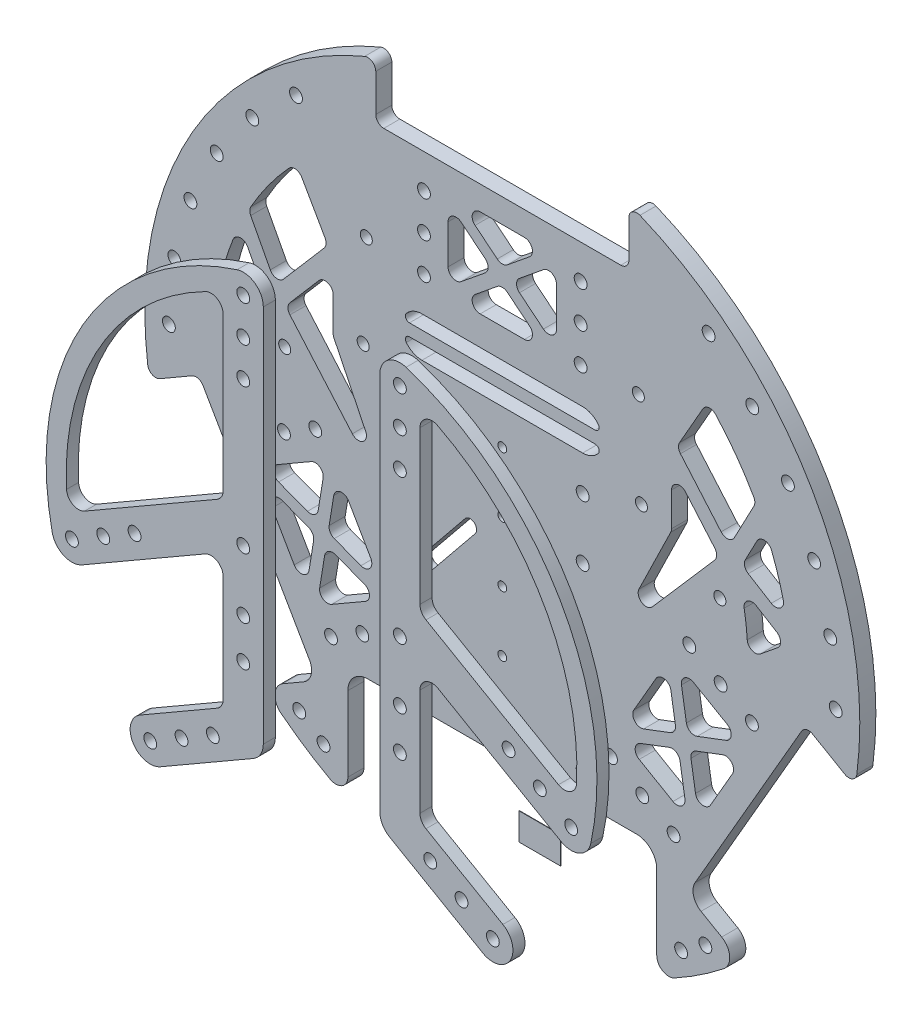
from build123d import *

# Parameters (mm, degrees)
SKETCH2_R             = 1.6
BOSS_EXTRUDE2_DEPTH   = 4
FILLET1_R             = 2
SKETCH6_R             = 1.6
CUT_EXTRUDE1_DEPTH    = 10
SKETCH14_R            = 1.6
CUT_EXTRUDE6_DEPTH    = 12
CRVPATTERN1_START     = -1
CRVPATTERN1_OUTLINE_R = 1.6
CRVPATTERN1_DEPTH     = 6
SKETCH15_W            = 27
SKETCH15_H            = 22
CUT_EXTRUDE8_DEPTH    = 12
EXTRUDE_THIN1_DEPTH   = 4
FILLET2_R             = 2
SKETCH18_R            = 1.5
CUT_EXTRUDE9_DEPTH    = 12
CUT_EXTRUDE10_DEPTH   = 10
CUT_EXTRUDE11_DEPTH   = 10
FILLET3_R             = 2
CUT_EXTRUDE12_START   = -10
CUT_EXTRUDE12_DEPTH   = 10
FILLET5_R             = 5
FILLET6_R             = 3
BOSS_EXTRUDE3_START   = -4
BOSS_EXTRUDE3_DEPTH   = 4
FILLET7_R             = 4
SKETCH29_R            = 1.6
CUT_EXTRUDE13_DEPTH   = 10
EXTRUDE_THIN5_DEPTH   = 4
FILLET8_DEPTH         = 4
BOSS_EXTRUDE4_DEPTH   = 3
FILLET9_R             = 3
FILLET10_R            = 3
BOSS_EXTRUDE5_DEPTH   = 3
FILLET11_R            = 3
FILLET12_R            = 3
SKETCH34_R            = 1.6
CUT_EXTRUDE14_DEPTH   = 131.743705865
SKETCH36_R            = 1.6
CUT_EXTRUDE15_DEPTH   = 5
SKETCH37_W            = 10.404424262
SKETCH37_H            = 6.743608318
BOSS_EXTRUDE6_DEPTH   = 0.1
SKETCH39_R            = 2.5
SKETCH39_R_2          = 1.1
BOSS_EXTRUDE7_DEPTH   = 4
CUT_EXTRUDE16_DEPTH   = 10
SKETCH41_W            = 50
SKETCH41_H            = 3
EXTRUDE_THIN7_DEPTH   = 4
FILLET13_R            = 1


with BuildPart() as part:
    # Sketch2 → Boss-Extrude2 (new body)
    with BuildSketch(Plane(origin=(0, 0, 0), x_dir=(-1, 0, 0), z_dir=(0, 0, 1))):
        with BuildLine():
            Line((-31.5, -83.239113402), (-31.5, -69))
            Line((-31.5, -69), (31.5, -69))
            Line((31.5, -69), (31.5, -83.239113402))
            ThreePointArc((31.5, -83.239113402), (73.227385588, -50.584088407), (89, 0))
            ThreePointArc((89, 0), (88.708820375, 7.193412794), (87.837186795, 14.339756482))
            Line((87.837186795, 14.339756482), (75.505752861, 7.220199781))
            Line((75.505752861, 7.220199781), (44.005752861, 61.779800219))
            Line((44.005752861, 61.779800219), (56.337186795, 68.89935692))
            ThreePointArc((56.337186795, 68.89935692), (0, 89), (-56.337186795, 68.89935692))
            Line((-56.337186795, 68.89935692), (-44.005752861, 61.779800219))
            Line((-44.005752861, 61.779800219), (-75.505752861, 7.220199781))
            Line((-75.505752861, 7.220199781), (-87.837186795, 14.339756482))
            ThreePointArc((-87.837186795, 14.339756482), (-77.076260937, -44.5), (-31.5, -83.239113402))
        make_face()
        with Locations(Location((-19.5, -60.5, 0), (0, 0, 180))):
            Circle(SKETCH2_R, mode=Mode.SUBTRACT)
        with Locations(Location((-19.5, -51.5, 0), (0, 0, 180))):
            Circle(SKETCH2_R, mode=Mode.SUBTRACT)
        with Locations(Location((-19.5, -42.5, 0), (0, 0, 180))):
            Circle(SKETCH2_R, mode=Mode.SUBTRACT)
        with Locations(Location((19.5, -60.5, 0), (0, 0, 180))):
            Circle(SKETCH2_R, mode=Mode.SUBTRACT)
        with Locations(Location((19.5, -51.5, 0), (0, 0, 180))):
            Circle(SKETCH2_R, mode=Mode.SUBTRACT)
        with Locations(Location((19.5, -42.5, 0), (0, 0, 180))):
            Circle(SKETCH2_R, mode=Mode.SUBTRACT)
        with Locations(Location((-46.556079661, 4.362504626, 0), (0, 0, 180))):
            Circle(SKETCH2_R, mode=Mode.SUBTRACT)
        with Locations(Location((-54.350308295, 8.862504626, 0), (0, 0, 180))):
            Circle(SKETCH2_R, mode=Mode.SUBTRACT)
        with Locations(Location((-62.144536929, 13.362504626, 0), (0, 0, 180))):
            Circle(SKETCH2_R, mode=Mode.SUBTRACT)
        with Locations(Location((-34.850308295, 42.637495374, 0), (0, 0, 180))):
            Circle(SKETCH2_R, mode=Mode.SUBTRACT)
        with Locations(Location((-27.056079661, 38.137495374, 0), (0, 0, 180))):
            Circle(SKETCH2_R, mode=Mode.SUBTRACT)
        with Locations(Location((-42.644536929, 47.137495374, 0), (0, 0, 180))):
            Circle(SKETCH2_R, mode=Mode.SUBTRACT)
        with Locations(Location((27.056079661, 38.137495374, 0), (0, 0, 180))):
            Circle(SKETCH2_R, mode=Mode.SUBTRACT)
        with Locations(Location((34.850308295, 42.637495374, 0), (0, 0, 180))):
            Circle(SKETCH2_R, mode=Mode.SUBTRACT)
        with Locations(Location((46.556079661, 4.362504626, 0), (0, 0, 180))):
            Circle(SKETCH2_R, mode=Mode.SUBTRACT)
        with Locations(Location((54.350308295, 8.862504626, 0), (0, 0, 180))):
            Circle(SKETCH2_R, mode=Mode.SUBTRACT)
        with Locations(Location((62.144536929, 13.362504626, 0), (0, 0, 180))):
            Circle(SKETCH2_R, mode=Mode.SUBTRACT)
        with Locations(Location((42.644536929, 47.137495374, 0), (0, 0, 180))):
            Circle(SKETCH2_R, mode=Mode.SUBTRACT)
    extrude(amount=BOSS_EXTRUDE2_DEPTH)

    # Fillet1
    fillet1_edges = [part.edges().sort_by_distance(p)[0] for p in [
        (75.505752861, -7.220199781, 2),
        (44.005752861, -61.779800219, 2),
        (56.337186795, -68.89935692, 2),
        (-56.337186795, -68.89935692, 2),
        (-44.005752861, -61.779800219, 2),
        (-75.505752861, -7.220199781, 2),
        (-87.837186795, -14.339756482, 2),
        (-31.5, 83.239113402, 2),
        (-31.5, 69, 2),
        (31.5, 69, 2),
        (31.5, 83.239113402, 2),
        (87.837186795, -14.339756482, 2),
    ]]
    fillet(fillet1_edges, radius=FILLET1_R)

    # Sketch6 → Cut-Extrude1 (cut)
    with BuildSketch(Plane.XY.offset(4)):
        with Locations((0, 15)):
            Circle(SKETCH6_R)
        Circle(SKETCH6_R)
        with Locations((0, -15)):
            Circle(SKETCH6_R)
        with Locations((0, -30)):
            Circle(SKETCH6_R)
        with Locations((0, -45)):
            Circle(SKETCH6_R)
        with Locations((0, -60)):
            Circle(SKETCH6_R)
        with Locations((0, -75)):
            Circle(SKETCH6_R)
        with Locations((-20, -75)):
            Circle(SKETCH6_R)
        with Locations((-20, -60)):
            Circle(SKETCH6_R)
        with Locations((-20, -45)):
            Circle(SKETCH6_R)
        with Locations((-20, -30)):
            Circle(SKETCH6_R)
        with Locations((-20, 0)):
            Circle(SKETCH6_R)
        with Locations((-20, 15)):
            Circle(SKETCH6_R)
        with Locations((20, -75)):
            Circle(SKETCH6_R)
        with Locations((20, -60)):
            Circle(SKETCH6_R)
        with Locations((20, -45)):
            Circle(SKETCH6_R)
        with Locations((20, -30)):
            Circle(SKETCH6_R)
        with Locations((20, 0)):
            Circle(SKETCH6_R)
        with Locations((20, 15)):
            Circle(SKETCH6_R)
    extrude(amount=-CUT_EXTRUDE1_DEPTH, mode=Mode.SUBTRACT)

    # Sketch14 → Cut-Extrude6 (cut)
    with BuildSketch(Plane.XY.offset(4)):
        with Locations((-83, 0)):
            Circle(SKETCH14_R)
    cut_extrude6 = extrude(amount=-CUT_EXTRUDE6_DEPTH, mode=Mode.SUBTRACT)

    # CrvPattern1: read off the stored shape, not the designer's step
    # CrvPattern1 outline → CrvPattern1 (cut)
    with BuildSketch(Plane.XY.offset(CRVPATTERN1_START)):
        with Locations((-51.358292788, 65.202191389)):
            Circle(CRVPATTERN1_OUTLINE_R)
        with Locations((-62.241362551, 54.909132099)):
            Circle(CRVPATTERN1_OUTLINE_R)
        with Locations((-71.097108739, 42.827574399)):
            Circle(CRVPATTERN1_OUTLINE_R)
        with Locations((-77.637082286, 29.351038383)):
            Circle(CRVPATTERN1_OUTLINE_R)
        with Locations((-81.648263392, 14.918481328)):
            Circle(CRVPATTERN1_OUTLINE_R)
    crvpattern1 = extrude(amount=CRVPATTERN1_DEPTH, mode=Mode.SUBTRACT)

    # Sketch15 → Cut-Extrude8 (cut)
    with BuildSketch(Plane.XY.offset(4)):
        with Locations((0, 52)):
            Rectangle(SKETCH15_W, SKETCH15_H)
        Polygon((61.309600438, -19.808657049), (47.809600438, -43.191342951), (28.757041555, -32.191342951), (42.257041555, -8.808657049), align=None)
        Polygon((-47.809600438, -43.191342951), (-61.309600438, -19.808657049), (-42.257041555, -8.808657049), (-28.757041555, -32.191342951), align=None)
    extrude(amount=-CUT_EXTRUDE8_DEPTH, mode=Mode.SUBTRACT)

    # Sketch16 → Extrude-Thin1 (add)
    with BuildSketch(Plane.XY.offset(4)):
        Polygon((-14.447509427, 61.837147522), (12.552490573, 39.837147522), (14.447509427, 42.162852478), (-12.552490573, 64.162852478), align=None)
        Polygon((12.552490573, 64.162852478), (-14.447509427, 42.162852478), (-12.552490573, 39.837147522), (14.447509427, 61.837147522), align=None)
        Polygon((60.776295365, -18.406663576), (28.223736481, -30.789349478), (29.290346629, -33.593336424), (61.842905512, -21.210650522), align=None)
        Polygon((49.290414939, -42.952201956), (43.737856056, -8.569516054), (40.776227055, -9.047798044), (46.328785938, -43.430483946), align=None)
        Polygon((-46.328785938, -43.430483946), (-40.776227055, -9.047798044), (-43.737856056, -8.569516054), (-49.290414939, -42.952201956), align=None)
        Polygon((-61.842905512, -21.210650522), (-29.290346629, -33.593336424), (-28.223736481, -30.789349478), (-60.776295365, -18.406663576), align=None)
    extrude(amount=-EXTRUDE_THIN1_DEPTH)

    # Fillet2
    fillet2_edges = [part.edges().sort_by_distance(p)[0] for p in [
        (-11.125353441, 41, 2),
        (11.125353441, 41, 2),
        (13.5, 61.065102804, 2),
        (13.5, 42.934897196, 2),
        (11.125353441, 63, 2),
        (-11.125353441, 63, 2),
        (-13.5, 42.934897196, 2),
        (-13.5, 61.065102804, 2),
        (-2.374646559, 52, 2),
        (0, 53.934897196, 2),
        (2.374646559, 52, 2),
        (0, 50.065102804, 2),
        (41.069718276, -10.865161294, 2),
        (29.944364835, -30.134838706, 2),
        (46.133930313, -42.223894353, 2),
        (30.432711681, -33.158791549, 2),
        (48.996923718, -41.134838706, 2),
        (60.122277159, -21.865161294, 2),
        (43.932711681, -9.776105647, 2),
        (59.633930313, -18.841208451, 2),
        (46.220644276, -23.943495755, 2),
        (46.708991123, -26.967448598, 2),
        (43.845997717, -28.056504245, 2),
        (43.357650871, -25.032551402, 2),
        (-29.944364835, -30.134838706, 2),
        (-41.069718276, -10.865161294, 2),
        (-59.633930313, -18.841208451, 2),
        (-43.932711681, -9.776105647, 2),
        (-60.122277159, -21.865161294, 2),
        (-48.996923718, -41.134838706, 2),
        (-30.432711681, -33.158791549, 2),
        (-46.133930313, -42.223894353, 2),
        (-43.845997717, -28.056504245, 2),
        (-46.708991123, -26.967448598, 2),
        (-46.220644276, -23.943495755, 2),
        (-43.357650871, -25.032551402, 2),
    ]]
    fillet(fillet2_edges, radius=FILLET2_R)

    # Sketch18 → Cut-Extrude9 (cut)
    with BuildSketch(Plane.XY.offset(4)):
        with Locations((-33.861381143, 43.340591448)):
            Circle(SKETCH18_R)
        with Locations((-34.641016151, 20)):
            Circle(SKETCH18_R)
        with Locations((-54.164426416, 9.550649772)):
            Circle(SKETCH18_R)
        with Locations((54.164426416, 9.550649772)):
            Circle(SKETCH18_R)
        with Locations((33.861381143, 43.340591448)):
            Circle(SKETCH18_R)
        with Locations((34.641016151, 20)):
            Circle(SKETCH18_R)
    extrude(amount=-CUT_EXTRUDE9_DEPTH, mode=Mode.SUBTRACT)

    # Sketch20 → Cut-Extrude10 (cut)
    with BuildSketch(Plane.XY.offset(4)):
        with BuildLine():
            Line((-21.242231703, -19.774285453), (-9.242231703, -4.991605039))
            ThreePointArc((-9.242231703, -4.991605039), (-6.991605039, -4.757768297), (-6.757768297, -7.008394961))
            Line((-6.757768297, -7.008394961), (-18.757768297, -21.791075375))
            ThreePointArc((-18.757768297, -21.791075375), (-21.008394961, -22.024912117), (-21.242231703, -19.774285453))
        make_face()
        with BuildLine():
            Line((21.242231703, -19.774285453), (9.242231703, -4.991605039))
            ThreePointArc((9.242231703, -4.991605039), (6.991605039, -4.757768297), (6.757768297, -7.008394961))
            Line((6.757768297, -7.008394961), (18.757768297, -21.791075375))
            ThreePointArc((18.757768297, -21.791075375), (21.008394961, -22.024912117), (21.242231703, -19.774285453))
        make_face()
    extrude(amount=-CUT_EXTRUDE10_DEPTH, mode=Mode.SUBTRACT)

    # Mirror1: Cut-Extrude6, CrvPattern1 across plane
    add(cut_extrude6.mirror(Plane.ZY), mode=Mode.SUBTRACT)
    add(crvpattern1.mirror(Plane.ZY), mode=Mode.SUBTRACT)

    # Sketch25 → Cut-Extrude11 (cut)
    with BuildSketch(Plane.XY.offset(4)):
        with BuildLine():
            Line((-45.60881259, 40.663577541), (-51.25208965, 50.568995506))
            ThreePointArc((-51.25208965, 50.568995506), (-58.929226505, 41.36842109), (-64.974112454, 31.022003655))
            Line((-64.974112454, 31.022003655), (-57.043295074, 21.903260293))
            ThreePointArc((-57.043295074, 21.903260293), (-52.176155261, 31.80155887), (-45.60881259, 40.663577541))
        make_face()
        with BuildLine():
            Line((-42.115005319, 34.531037716), (-45.60881259, 40.663577541))
            ThreePointArc((-45.60881259, 40.663577541), (-52.176155261, 31.80155887), (-57.043295074, 21.903260293))
            Line((-57.043295074, 21.903260293), (-27.372248825, -12.212095415))
            Line((-27.372248825, -12.212095415), (-42.115005319, 18.019554165))
            Line((-42.115005319, 18.019554165), (-42.115005319, 34.531037716))
        make_face()
        with BuildLine():
            Line((-57.043295074, 21.903260293), (-64.974112454, 31.022003655))
            ThreePointArc((-64.974112454, 31.022003655), (-69.162799491, 20.012675147), (-71.500335484, 8.467704866))
            Line((-71.500335484, 8.467704866), (-61.103930515, 0))
            ThreePointArc((-61.103930515, 0), (-60.080195834, 11.138240118), (-57.043295074, 21.903260293))
        make_face()
        with BuildLine():
            ThreePointArc((57.043295074, 21.903260293), (52.176155261, 31.80155887), (45.60881259, 40.663577541))
            Line((45.60881259, 40.663577541), (42.115005319, 34.531037716))
            Line((42.115005319, 34.531037716), (42.115005319, 18.019554165))
            Line((42.115005319, 18.019554165), (27.372248825, -12.212095415))
            Line((27.372248825, -12.212095415), (57.043295074, 21.903260293))
        make_face()
        with BuildLine():
            ThreePointArc((64.974112454, 31.022003655), (58.929226505, 41.36842109), (51.25208965, 50.568995506))
            Line((51.25208965, 50.568995506), (45.60881259, 40.663577541))
            ThreePointArc((45.60881259, 40.663577541), (52.176155261, 31.80155887), (57.043295074, 21.903260293))
            Line((57.043295074, 21.903260293), (64.974112454, 31.022003655))
        make_face()
        with BuildLine():
            ThreePointArc((71.500335484, 8.467704866), (69.162799491, 20.012675147), (64.974112454, 31.022003655))
            Line((64.974112454, 31.022003655), (57.043295074, 21.903260293))
            ThreePointArc((57.043295074, 21.903260293), (60.080195834, 11.138240118), (61.103930515, 0))
            Line((61.103930515, 0), (71.500335484, 8.467704866))
        make_face()
    extrude(amount=-CUT_EXTRUDE11_DEPTH, mode=Mode.SUBTRACT)

    # Fillet3
    fillet3_edges = [part.edges().sort_by_distance(p)[0] for p in [
        (-57.043295074, 21.903260293, 2),
        (-61.103930515, 0, 2),
        (-71.500335484, 8.467704866, 2),
        (-51.25208965, 50.568995506, 2),
        (-42.115005319, 34.531037716, 2),
        (-42.115005319, 18.019554165, 2),
        (-27.372248825, -12.212095415, 2),
        (57.043295074, 21.903260293, 2),
        (27.372248825, -12.212095415, 2),
        (42.115005319, 18.019554165, 2),
        (42.115005319, 34.531037716, 2),
        (51.25208965, 50.568995506, 2),
        (71.500335484, 8.467704866, 2),
        (61.103930515, 0, 2),
    ]]
    fillet(fillet3_edges, radius=FILLET3_R)

    # Sketch27 → Cut-Extrude12 (cut)
    with BuildSketch(Plane.XY.offset(4).offset(CUT_EXTRUDE12_START)):
        with BuildLine():
            Line((-38.447158109, -80.267154137), (-38.447158109, -51.691106138))
            Line((-38.447158109, -51.691106138), (38.447158109, -51.691106138))
            Line((38.447158109, -51.691106138), (38.447158109, -80.267154137))
            ThreePointArc((38.447158109, -80.267154137), (0, -89), (-38.447158109, -80.267154137))
        make_face()
    extrude(amount=CUT_EXTRUDE12_DEPTH, mode=Mode.SUBTRACT)

    # Fillet5
    fillet5_edges = [part.edges().sort_by_distance(p)[0] for p in [
        (-38.447158109, -51.691106138, 2),
        (38.447158109, -51.691106138, 2),
    ]]
    fillet(fillet5_edges, radius=FILLET5_R)

    # Fillet6
    fillet6_edges = [part.edges().sort_by_distance(p)[0] for p in [
        (38.447158109, -80.267154137, 2),
        (-38.447158109, -80.267154137, 2),
    ]]
    fillet(fillet6_edges, radius=FILLET6_R)

    # Sketch28 → Boss-Extrude3 (add)
    with BuildSketch(Plane.XY.offset(4).offset(BOSS_EXTRUDE3_START)):
        with BuildLine():
            Line((-59.554587169, -66.138121739), (-46.005752861, -58.315698604))
            Line((-46.005752861, -58.315698604), (-45.005752861, -60.047749412))
            ThreePointArc((-45.005752861, -60.047749412), (-44.805952016, -61.565387502), (-45.737803669, -62.779800219))
            Line((-45.737803669, -62.779800219), (-53.784613683, -67.425628147))
            ThreePointArc((-53.784613683, -67.425628147), (-54.780498032, -69.029438312), (-53.998053078, -70.747510655))
            ThreePointArc((-53.998053078, -70.747510655), (-56.823077559, -68.499181431), (-59.554587169, -66.138121739))
        make_face()
        with BuildLine():
            Line((46.005752861, -58.315698604), (45.005752861, -60.047749412))
            ThreePointArc((45.005752861, -60.047749412), (44.805952016, -61.565387502), (45.737803669, -62.779800219))
            Line((45.737803669, -62.779800219), (53.784613683, -67.425628147))
            ThreePointArc((53.784613683, -67.425628147), (54.780498032, -69.029438312), (53.998053078, -70.747510655))
            ThreePointArc((53.998053078, -70.747510655), (56.823077559, -68.499181431), (59.554587169, -66.138121739))
            Line((59.554587169, -66.138121739), (46.005752861, -58.315698604))
        make_face()
    extrude(amount=BOSS_EXTRUDE3_DEPTH)

    # Fillet7
    fillet7_edges = [part.edges().sort_by_distance(p)[0] for p in [
        (-59.554587169, -66.138121739, 2),
        (-46.005752861, -58.315698604, 2),
        (46.005752861, -58.315698604, 2),
        (59.554587169, -66.138121739, 2),
    ]]
    fillet(fillet7_edges, radius=FILLET7_R)

    # Sketch29 → Cut-Extrude13 (cut)
    with BuildSketch(Plane.XY.offset(4)):
        with Locations((-50.552461945, -67.085382844)):
            Circle(SKETCH29_R)
        with Locations((-44.513218196, -71.236040077)):
            Circle(SKETCH29_R)
        with Locations((44.513218196, -71.236040077)):
            Circle(SKETCH29_R)
        with Locations((50.552461945, -67.085382844)):
            Circle(SKETCH29_R)
    extrude(amount=-CUT_EXTRUDE13_DEPTH, mode=Mode.SUBTRACT)

    # Sketch30 → Extrude-Thin5 (add)
    with BuildSketch(Plane.XY.offset(4)):
        Polygon((-54.900927203, 17.362874752), (-39.036044939, 35.820335158), (-42.06947896, 38.427685928), (-57.934361224, 19.970225522), align=None)
        Polygon((-67.212879237, 33.728533867), (-58.784303311, 17.73414963), (-55.245586428, 19.598950643), (-63.674162354, 35.59333488), align=None)
        Polygon((-71.764418637, 7.205857639), (-56.243823347, 16.72707487), (-58.335443849, 20.136638431), (-73.85603914, 10.6154212), align=None)
        Polygon((57.934361224, 19.970225522), (42.06947896, 38.427685928), (39.036044939, 35.820335158), (54.900927203, 17.362874752), align=None)
        Polygon((73.85603914, 10.6154212), (58.335443849, 20.136638431), (56.243823347, 16.72707487), (71.764418637, 7.205857639), align=None)
        Polygon((63.674162354, 35.59333488), (55.245586428, 19.598950643), (58.784303311, 17.73414963), (67.212879237, 33.728533867), align=None)
    extrude(amount=-EXTRUDE_THIN5_DEPTH)

    # Fillet8: read off the stored shape, not the designer's step
    # Fillet8 outline → Fillet8 (add)
    with BuildSketch(Plane.XY):
        with BuildLine():
            ThreePointArc((-68.543569567, 6.059466517), (-69.276094486, 7.743343966), (-68.326342307, 9.314969499))
            Line((-68.326342307, 9.314969499), (-70.727121249, 7.842194943))
            ThreePointArc((-70.727121249, 7.842194943), (-70.684157671, 7.804006529), (-70.640114371, 7.767068586))
            Line((-70.640114371, 7.767068586), (-68.543569567, 6.059466517))
        make_face()
        with BuildLine():
            ThreePointArc((-63.229627341, 12.441584777), (-61.061543366, 12.392249067), (-60.212978931, 10.39651348))
            ThreePointArc((-60.212978931, 10.39651348), (-59.781515869, 12.643602521), (-59.26622414, 14.872962062))
            Line((-59.26622414, 14.872962062), (-63.229627341, 12.441584777))
        make_face()
        with BuildLine():
            Line((-59.631397127, 19.34162687), (-60.504847484, 20.99911928))
            ThreePointArc((-60.504847484, 20.99911928), (-60.345481919, 19.537546114), (-61.228395674, 18.361936994))
            Line((-61.228395674, 18.361936994), (-59.631397127, 19.34162687))
        make_face()
        with BuildLine():
            ThreePointArc((-67.029561536, 26.287599364), (-65.278816581, 27.554295225), (-63.398270829, 26.489788778))
            Line((-63.398270829, 26.489788778), (-65.357061011, 30.206863061))
            ThreePointArc((-65.357061011, 30.206863061), (-66.222312058, 28.259606962), (-67.029561536, 26.287599364))
        make_face()
        with BuildLine():
            Line((-70.921443556, 12.41566929), (-66.971117667, 14.839024208))
            ThreePointArc((-66.971117667, 14.839024208), (-69.194520975, 14.927243403), (-69.960268716, 17.016486159))
            ThreePointArc((-69.960268716, 17.016486159), (-70.478408695, 14.723922978), (-70.921443556, 12.41566929))
        make_face()
        with BuildLine():
            ThreePointArc((-44.129692263, 38.067336933), (-43.876682332, 36.885447704), (-44.35074193, 35.773627723))
            Line((-44.35074193, 35.773627723), (-43.431931906, 36.842586154))
            Line((-43.431931906, 36.842586154), (-44.129692263, 38.067336933))
        make_face()
        with BuildLine():
            ThreePointArc((-54.472954777, 23.997281719), (-56.214211722, 23.313601621), (-57.75903023, 24.368556598))
            Line((-57.75903023, 24.368556598), (-56.388800164, 21.768356236))
            Line((-56.388800164, 21.768356236), (-54.472954777, 23.997281719))
        make_face()
        with BuildLine():
            ThreePointArc((-62.640574787, 33.631960049), (-62.870969287, 34.595795797), (-62.610393955, 35.551913714))
            ThreePointArc((-62.610393955, 35.551913714), (-62.880109328, 35.072665295), (-63.146156386, 34.591370799))
            Line((-63.146156386, 34.591370799), (-62.640574787, 33.631960049))
        make_face()
        with BuildLine():
            Line((-42.115005319, 32.238222895), (-45.63172233, 28.146817494))
            ThreePointArc((-45.63172233, 28.146817494), (-43.41981974, 28.718433289), (-42.115005319, 26.843142109))
            Line((-42.115005319, 26.843142109), (-42.115005319, 32.238222895))
        make_face()
        with BuildLine():
            ThreePointArc((-52.868175462, 17.102765916), (-53.359076821, 18.409431839), (-52.87580233, 19.718937755))
            Line((-52.87580233, 19.718937755), (-54.002985477, 18.407554666))
            Line((-54.002985477, 18.407554666), (-52.868175462, 17.102765916))
        make_face()
        with BuildLine():
            Line((70.727121249, 7.842194943), (68.326342307, 9.314969499))
            ThreePointArc((68.326342307, 9.314969499), (69.276094486, 7.743343966), (68.543569567, 6.059466517))
            Line((68.543569567, 6.059466517), (70.640114371, 7.767068586))
            ThreePointArc((70.640114371, 7.767068586), (70.684157671, 7.804006529), (70.727121249, 7.842194943))
        make_face()
        with BuildLine():
            ThreePointArc((60.212978931, 10.39651348), (61.061543366, 12.392249067), (63.229627341, 12.441584777))
            Line((63.229627341, 12.441584777), (59.26622414, 14.872962062))
            ThreePointArc((59.26622414, 14.872962062), (59.781515869, 12.643602521), (60.212978931, 10.39651348))
        make_face()
        with BuildLine():
            ThreePointArc((63.398270829, 26.489788778), (65.278816581, 27.554295225), (67.029561536, 26.287599364))
            ThreePointArc((67.029561536, 26.287599364), (66.222312058, 28.259606962), (65.357061011, 30.206863061))
            Line((65.357061011, 30.206863061), (63.398270829, 26.489788778))
        make_face()
        with BuildLine():
            ThreePointArc((70.921443556, 12.41566929), (70.478408695, 14.723922978), (69.960268716, 17.016486159))
            ThreePointArc((69.960268716, 17.016486159), (69.194520975, 14.927243403), (66.971117667, 14.839024208))
            Line((66.971117667, 14.839024208), (70.921443556, 12.41566929))
        make_face()
        with BuildLine():
            ThreePointArc((61.228395674, 18.361936994), (60.345481919, 19.537546114), (60.504847484, 20.99911928))
            Line((60.504847484, 20.99911928), (59.631397127, 19.34162687))
            Line((59.631397127, 19.34162687), (61.228395674, 18.361936994))
        make_face()
        with BuildLine():
            Line((56.388800164, 21.768356236), (57.75903023, 24.368556598))
            ThreePointArc((57.75903023, 24.368556598), (56.214211722, 23.313601621), (54.472954777, 23.997281719))
            Line((54.472954777, 23.997281719), (56.388800164, 21.768356236))
        make_face()
        with BuildLine():
            ThreePointArc((62.610393955, 35.551913714), (62.870969287, 34.595795797), (62.640574787, 33.631960049))
            Line((62.640574787, 33.631960049), (63.146156386, 34.591370799))
            ThreePointArc((63.146156386, 34.591370799), (62.880109328, 35.072665295), (62.610393955, 35.551913714))
        make_face()
        with BuildLine():
            Line((43.431931906, 36.842586154), (44.35074193, 35.773627723))
            ThreePointArc((44.35074193, 35.773627723), (43.876682332, 36.885447704), (44.129692263, 38.067336933))
            Line((44.129692263, 38.067336933), (43.431931906, 36.842586154))
        make_face()
        with BuildLine():
            Line((54.002985477, 18.407554666), (52.87580233, 19.718937755))
            ThreePointArc((52.87580233, 19.718937755), (53.359076821, 18.409431839), (52.868175462, 17.102765916))
            Line((52.868175462, 17.102765916), (54.002985477, 18.407554666))
        make_face()
        with BuildLine():
            ThreePointArc((42.115005319, 26.843142109), (43.41981974, 28.718433289), (45.63172233, 28.146817494))
            Line((45.63172233, 28.146817494), (42.115005319, 32.238222895))
            Line((42.115005319, 32.238222895), (42.115005319, 26.843142109))
        make_face()
    extrude(amount=FILLET8_DEPTH)

    # Sketch39 → Boss-Extrude7 (add)
    # profile 1 of 5: a face of its own
    with BuildSketch(Plane.XY.offset(4)):
        with Locations((0, 15)):
            Circle(SKETCH39_R)
        with Locations((0, 15)):
            Circle(SKETCH39_R_2, mode=Mode.SUBTRACT)
    # profile 2 of 5: a face of its own
    with BuildSketch(Plane.XY.offset(4)):
        Circle(SKETCH39_R)
        Circle(SKETCH39_R_2, mode=Mode.SUBTRACT)
    # profile 3 of 5: a face of its own
    with BuildSketch(Plane.XY.offset(4)):
        with Locations((0, -15)):
            Circle(SKETCH39_R)
        with Locations((0, -15)):
            Circle(SKETCH39_R_2, mode=Mode.SUBTRACT)
    # profile 4 of 5: a face of its own
    with BuildSketch(Plane.XY.offset(4)):
        with Locations((0, -30)):
            Circle(SKETCH39_R)
        with Locations((0, -30)):
            Circle(SKETCH39_R_2, mode=Mode.SUBTRACT)
    # profile 5 of 5: a face of its own
    with BuildSketch(Plane.XY.offset(4)):
        with Locations((0, -45)):
            Circle(SKETCH39_R)
        with Locations((0, -45)):
            Circle(SKETCH39_R_2, mode=Mode.SUBTRACT)
    extrude(amount=-BOSS_EXTRUDE7_DEPTH)

    # Sketch40 → Cut-Extrude16 (cut)
    with BuildSketch(Plane(origin=(0, 0, 0), x_dir=(-1, 0, 0), z_dir=(0, 0, -1))):
        with BuildLine():
            Line((-20, 33.754545455), (20, 33.754545455))
            ThreePointArc((20, 33.754545455), (25, 28.754545455), (20, 23.754545455))
            Line((20, 23.754545455), (-20, 23.754545455))
            ThreePointArc((-20, 23.754545455), (-25, 28.754545455), (-20, 33.754545455))
        make_face()
    extrude(amount=-CUT_EXTRUDE16_DEPTH, mode=Mode.SUBTRACT)

    # Sketch41 → Extrude-Thin7 (add)
    with BuildSketch(Plane(origin=(0, 0, 0), x_dir=(-1, 0, 0), z_dir=(0, 0, -1))):
        with Locations((0, 28.754545455)):
            Rectangle(SKETCH41_W, SKETCH41_H)
    extrude(amount=-EXTRUDE_THIN7_DEPTH)

    # Fillet13
    fillet13_edges = [part.edges().sort_by_distance(p)[0] for p in [
        (-24.769696007, 30.254545455, 2),
        (-24.769696007, 27.254545455, 2),
        (24.769696007, 27.254545455, 2),
        (24.769696007, 30.254545455, 2),
    ]]
    fillet(fillet13_edges, radius=FILLET13_R)


with BuildPart() as body_2:
    # Sketch32 → Boss-Extrude4 (new body)
    with BuildSketch(Plane.XY.offset(46)):
        with BuildLine():
            Line((-24.5, -37.020423453), (-24.5, -30.888239402))
            Line((-24.5, -30.888239402), (-45.144536929, -42.807368355))
            ThreePointArc((-45.144536929, -42.807368355), (-46.974663948, -49.637495374), (-40.144536929, -51.467622393))
            Line((-40.144536929, -51.467622393), (-22.298253984, -41.164066131))
            ThreePointArc((-22.298253984, -41.164066131), (-23.915386162, -39.366561778), (-24.5, -37.020423453))
        make_face()
        with BuildLine():
            ThreePointArc((-17, -38.105117767), (-15.169872981, -36.274990748), (-14.5, -33.774990748))
            ThreePointArc((-14.5, -33.774990748), (-17, -29.444863729), (-22, -29.444863729))
            Line((-22, -29.444863729), (-24.5, -30.888239402))
            Line((-24.5, -30.888239402), (-24.5, -37.020423453))
            ThreePointArc((-24.5, -37.020423453), (-23.915386162, -39.366561778), (-22.298253984, -41.164066131))
            Line((-22.298253984, -41.164066131), (-17, -38.105117767))
        make_face()
        with BuildLine():
            Line((-14.5, -33.774990748), (-14.5, 8.371578903))
            Line((-14.5, 8.371578903), (-24.5, 2.598076211))
            Line((-24.5, 2.598076211), (-24.5, -30.888239402))
            Line((-24.5, -30.888239402), (-22, -29.444863729))
            ThreePointArc((-22, -29.444863729), (-17, -29.444863729), (-14.5, -33.774990748))
        make_face()
        with BuildLine():
            Line((-24.5, 2.598076211), (-24.5, 14.145081595))
            Line((-24.5, 14.145081595), (-64.644536929, -9.032377607))
            ThreePointArc((-64.644536929, -9.032377607), (-66.474663948, -15.862504626), (-59.644536929, -17.692631645))
            Line((-59.644536929, -17.692631645), (-24.5, 2.598076211))
        make_face()
        Polygon((-14.5, 8.371578903), (-14.5, 19.918584287), (-24.5, 14.145081595), (-24.5, 2.598076211), align=None)
        with BuildLine():
            Line((-14.5, 19.918584287), (-14.5, 60.5))
            ThreePointArc((-14.5, 60.5), (-19.5, 65.5), (-24.5, 60.5))
            Line((-24.5, 60.5), (-24.5, 14.145081595))
            Line((-24.5, 14.145081595), (-14.5, 19.918584287))
        make_face()
        with BuildLine():
            Line((14.5, 60.5), (14.5, 19.918584287))
            Line((14.5, 19.918584287), (24.5, 14.145081595))
            Line((24.5, 14.145081595), (24.5, 60.5))
            ThreePointArc((24.5, 60.5), (19.5, 65.5), (14.5, 60.5))
        make_face()
        Polygon((14.5, 19.918584287), (14.5, 8.371578903), (24.5, 2.598076211), (24.5, 14.145081595), align=None)
        with BuildLine():
            Line((24.5, 14.145081595), (24.5, 2.598076211))
            Line((24.5, 2.598076211), (59.644536929, -17.692631645))
            ThreePointArc((59.644536929, -17.692631645), (66.474663948, -15.862504626), (64.644536929, -9.032377607))
            Line((64.644536929, -9.032377607), (24.5, 14.145081595))
        make_face()
        with BuildLine():
            Line((24.5, 2.598076211), (14.5, 8.371578903))
            Line((14.5, 8.371578903), (14.5, -33.774990748))
            ThreePointArc((14.5, -33.774990748), (17, -29.444863729), (22, -29.444863729))
            Line((22, -29.444863729), (24.5, -30.888239402))
            Line((24.5, -30.888239402), (24.5, 2.598076211))
        make_face()
        with BuildLine():
            ThreePointArc((22, -29.444863729), (17, -29.444863729), (14.5, -33.774990748))
            ThreePointArc((14.5, -33.774990748), (15.169872981, -36.274990748), (17, -38.105117767))
            Line((17, -38.105117767), (22.298253984, -41.164066131))
            ThreePointArc((22.298253984, -41.164066131), (23.915386162, -39.366561778), (24.5, -37.020423453))
            Line((24.5, -37.020423453), (24.5, -30.888239402))
            Line((24.5, -30.888239402), (22, -29.444863729))
        make_face()
        with BuildLine():
            Line((45.144536929, -42.807368355), (24.5, -30.888239402))
            Line((24.5, -30.888239402), (24.5, -37.020423453))
            ThreePointArc((24.5, -37.020423453), (23.915386162, -39.366561778), (22.298253984, -41.164066131))
            Line((22.298253984, -41.164066131), (40.144536929, -51.467622393))
            ThreePointArc((40.144536929, -51.467622393), (46.974663948, -49.637495374), (45.144536929, -42.807368355))
        make_face()
    extrude(amount=BOSS_EXTRUDE4_DEPTH)

    # Fillet9
    fillet9_edges = [body_2.edges().sort_by_distance(p)[0] for p in [
        (-24.5, -30.888239402, 47.5),
        (-24.5, 2.598076211, 47.5),
        (-24.5, 14.145081595, 47.5),
    ]]
    fillet(fillet9_edges, radius=FILLET9_R)

    # Fillet10
    fillet10_edges = [body_2.edges().sort_by_distance(p)[0] for p in [
        (24.5, 14.145081595, 47.5),
        (24.5, 2.598076211, 47.5),
        (24.5, -30.888239402, 47.5),
    ]]
    fillet(fillet10_edges, radius=FILLET10_R)

    # Sketch33 → Boss-Extrude5 (add)
    with BuildSketch(Plane.XY.offset(49)):
        with BuildLine():
            Line((-21.033864726, 65.258913637), (-19.5, 60.5))
            ThreePointArc((-19.5, 60.5), (-55.04884195, 31.782463718), (-62.144536929, -13.362504626))
            Line((-62.144536929, -13.362504626), (-67.032809396, -14.413595626))
            ThreePointArc((-67.032809396, -14.413595626), (-59.378968969, 34.282463718), (-21.033864726, 65.258913637))
        make_face()
        with BuildLine():
            Line((67.032809396, -14.413595626), (62.144536929, -13.362504626))
            ThreePointArc((62.144536929, -13.362504626), (55.04884195, 31.782463718), (19.5, 60.5))
            Line((19.5, 60.5), (21.033864726, 65.258913637))
            ThreePointArc((21.033864726, 65.258913637), (59.378968969, 34.282463718), (67.032809396, -14.413595626))
        make_face()
    extrude(amount=-BOSS_EXTRUDE5_DEPTH)

    # Fillet11
    fillet11_edges = [body_2.edges().sort_by_distance(p)[0] for p in [
        (-63.045546065, -8.109199801, 47.5),
        (-24.5, 58.653644388, 47.5),
    ]]
    fillet(fillet11_edges, radius=FILLET11_R)

    # Fillet12
    fillet12_edges = [body_2.edges().sort_by_distance(p)[0] for p in [
        (24.5, 58.653644388, 47.5),
        (63.045546065, -8.109199801, 47.5),
    ]]
    fillet(fillet12_edges, radius=FILLET12_R)

    # Sketch34 → Cut-Extrude14 (cut, through all)
    with BuildSketch(Plane.XY.offset(49)):
        with Locations((62.144536929, -13.362504626)):
            Circle(SKETCH34_R)
        with Locations((54.350308295, -8.862504626)):
            Circle(SKETCH34_R)
        with Locations((46.556079661, -4.362504626)):
            Circle(SKETCH34_R)
        with Locations((27.056079661, -38.137495374)):
            Circle(SKETCH34_R)
        with Locations((34.850308295, -42.637495374)):
            Circle(SKETCH34_R)
        with Locations((42.644536929, -47.137495374)):
            Circle(SKETCH34_R)
        with Locations((-27.056079661, -38.137495374)):
            Circle(SKETCH34_R)
        with Locations((-34.850308295, -42.637495374)):
            Circle(SKETCH34_R)
        with Locations((-42.644536929, -47.137495374)):
            Circle(SKETCH34_R)
        with Locations((-46.556079661, -4.362504626)):
            Circle(SKETCH34_R)
        with Locations((-54.350308295, -8.862504626)):
            Circle(SKETCH34_R)
        with Locations((-62.144536929, -13.362504626)):
            Circle(SKETCH34_R)
        with Locations((19.5, 42.5)):
            Circle(SKETCH34_R)
        with Locations((19.5, 51.5)):
            Circle(SKETCH34_R)
        with Locations((19.5, 60.5)):
            Circle(SKETCH34_R)
        with Locations((-19.5, 42.5)):
            Circle(SKETCH34_R)
        with Locations((-19.5, 51.5)):
            Circle(SKETCH34_R)
        with Locations((-19.5, 60.5)):
            Circle(SKETCH34_R)
    extrude(amount=-CUT_EXTRUDE14_DEPTH, mode=Mode.SUBTRACT)

    # Sketch36 → Cut-Extrude15 (cut)
    with BuildSketch(Plane.XY.offset(49)):
        with Locations((-19.5, -18.5)):
            Circle(SKETCH36_R)
        with Locations((-19.5, -8.5)):
            Circle(SKETCH36_R)
        with Locations((-19.5, 6.5)):
            Circle(SKETCH36_R)
        with Locations((19.5, -18.5)):
            Circle(SKETCH36_R)
        with Locations((19.5, -8.5)):
            Circle(SKETCH36_R)
        with Locations((19.5, 6.5)):
            Circle(SKETCH36_R)
    extrude(amount=-CUT_EXTRUDE15_DEPTH, mode=Mode.SUBTRACT)


with BuildPart() as body_3:
    # Sketch37 → Boss-Extrude6 (new body)
    with BuildSketch(Plane(origin=(0, 0, -8.665), x_dir=(-1, 0, 0), z_dir=(0, 0, -1))):
        with Locations((3.318722688, -77.336330806)):
            Rectangle(SKETCH37_W, SKETCH37_H)
    extrude(amount=BOSS_EXTRUDE6_DEPTH)


solid = Compound([part.part, body_2.part, body_3.part])
